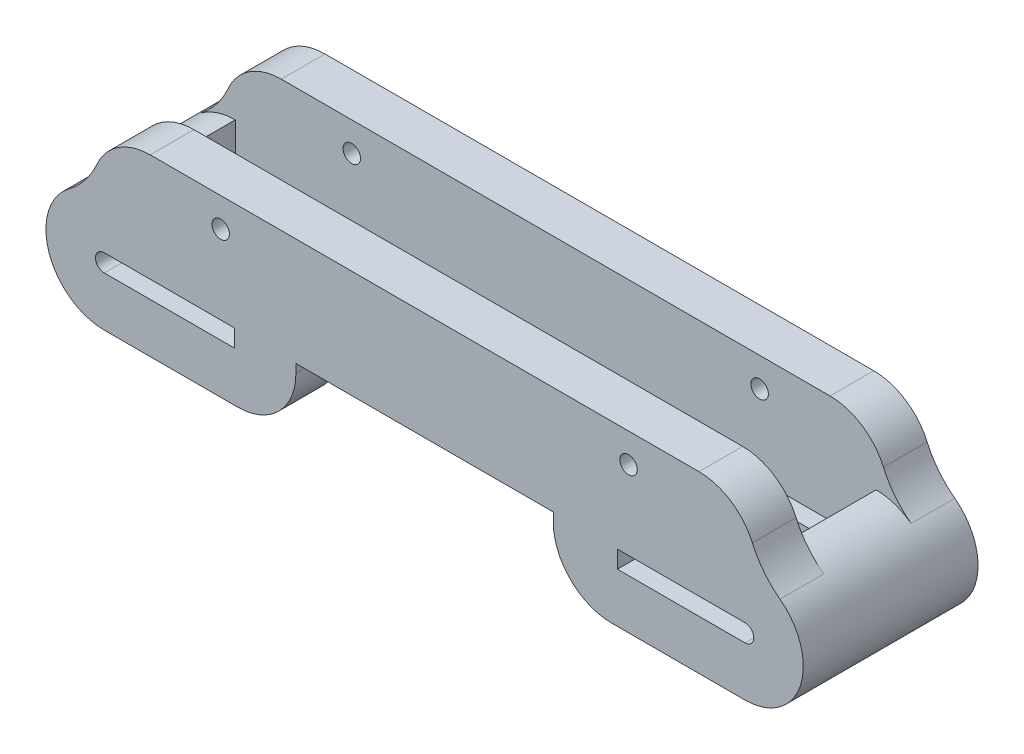
from build123d import *

# Parameters (mm, degrees)
BOSS_EXTRU_1_DEPTH           = 30
ESQUISSE2_W                  = 110
ESQUISSE2_H                  = 15
ENL_V_MAT_EXTRU_1_DEPTH      = 30
ENL_V_START                  = -10
ESQUISSE3_W                  = 44.19
ESQUISSE3_H                  = 7.5
ENL_V_MAT_EXTRU_2_DEPTH      = 10
ESQUISSE4_W                  = 5
ESQUISSE4_H                  = 7.5
BOSS_EXTRU_2_DEPTH           = 10
ESQUISSE5_W                  = 7.5
ESQUISSE5_H                  = 3
BOSS_EXTRU_3_DEPTH           = 6
ESQUISSE6_W                  = 7.5
ESQUISSE6_H                  = 3
BOSS_EXTRU_4_DEPTH           = 5.5
CONG_1_R                     = 10
ESQUISSE7_W                  = 110
ESQUISSE7_H                  = 7.5
BOSS_EXTRU_5_DEPTH           = 10
ENL_V_MAT_EXTRU_3_DEPTH      = 72.632743909
ENL_V_MAT_EXTRU_3_DEPTH_BACK = 72.632743909
ESQUISSE8_R                  = 1.5
CONG_2_R                     = 15
CONG_3_R                     = 15
CONG_4_R                     = 15
CONG_5_R                     = 15
CONG_6_R                     = 10


with BuildPart() as part:
    # Esquisse1 → Boss.-Extru.1 (new body)
    with BuildSketch(Plane.XY):
        with BuildLine():
            Line((-55, 10), (55, 10))
            ThreePointArc((55, 10), (65, 0), (55, -10))
            Line((55, -10), (-55, -10))
            ThreePointArc((-55, -10), (-65, 0), (-55, 10))
        make_face()
        with BuildLine():
            Line((-55, 1.5), (55, 1.5))
            ThreePointArc((55, 1.5), (56.5, 0), (55, -1.5))
            Line((55, -1.5), (-55, -1.5))
            ThreePointArc((-55, -1.5), (-56.5, 0), (-55, 1.5))
        make_face(mode=Mode.SUBTRACT)
    extrude(amount=BOSS_EXTRU_1_DEPTH)

    # Esquisse2 → Enlèv. mat.-Extru.1 (cut)
    with BuildSketch(Plane(origin=(0, 10, 0), x_dir=(1, 0, 0), z_dir=(0, 1, 0))):
        with Locations((0, -15)):
            Rectangle(ESQUISSE2_W, ESQUISSE2_H)
    extrude(amount=-ENL_V_MAT_EXTRU_1_DEPTH, mode=Mode.SUBTRACT)

    # Esquisse3 → Enlèv. mat.-Extru.2 (cut)
    with BuildSketch(Plane(origin=(0, 10, 0), x_dir=(1, 0, 0), z_dir=(0, 1, 0)).offset(ENL_V_START)):
        with Locations((0, -26.25)):
            Rectangle(ESQUISSE3_W, ESQUISSE3_H)
    extrude(amount=-ENL_V_MAT_EXTRU_2_DEPTH, mode=Mode.SUBTRACT)

    # Esquisse4 → Boss.-Extru.2 (add)
    with BuildSketch(Plane(origin=(0, -1.5, 0), x_dir=(1, 0, 0), z_dir=(0, 1, 0))):
        with Locations((-24.595, -26.25)):
            Rectangle(ESQUISSE4_W, ESQUISSE4_H)
        with Locations((24.595, -26.25)):
            Rectangle(ESQUISSE4_W, ESQUISSE4_H)
    extrude(amount=BOSS_EXTRU_2_DEPTH)

    # Esquisse5 → Boss.-Extru.3 (add)
    with BuildSketch(Plane(origin=(27.095, 0, 0), x_dir=(0, 0, -1), z_dir=(1, 0, 0))):
        with Locations((-26.25, 0)):
            Rectangle(ESQUISSE5_W, ESQUISSE5_H)
    extrude(amount=BOSS_EXTRU_3_DEPTH)

    # Esquisse6 → Boss.-Extru.4 (add)
    with BuildSketch(Plane.ZY.offset(27.095)):
        with Locations((26.25, 0)):
            Rectangle(ESQUISSE6_W, ESQUISSE6_H)
    extrude(amount=BOSS_EXTRU_4_DEPTH)

    # Congé1
    cong_1_edges = [part.edges().sort_by_distance(p)[0] for p in [
        (22.095, -10, 26.25),
        (-22.095, -10, 26.25),
    ]]
    fillet(cong_1_edges, radius=CONG_1_R)

    # Esquisse7 → Boss.-Extru.5 (add)
    with BuildSketch(Plane(origin=(0, 10, 0), x_dir=(1, 0, 0), z_dir=(0, 1, 0))):
        with Locations((0, -3.75)):
            Rectangle(ESQUISSE7_W, ESQUISSE7_H)
        with Locations((0, -26.25)):
            Rectangle(ESQUISSE7_W, ESQUISSE7_H)
    extrude(amount=BOSS_EXTRU_5_DEPTH)

    # Esquisse8 → Enlèv. mat.-Extru.3 (cut, two sides: drawn at the far end of the back side and taken through both)
    with BuildSketch(Plane.XY.offset(7.5).offset(-ENL_V_MAT_EXTRU_3_DEPTH_BACK)):
        with Locations((-35, 15)):
            Circle(ESQUISSE8_R)
        with Locations((35, 15)):
            Circle(ESQUISSE8_R)
    extrude(amount=ENL_V_MAT_EXTRU_3_DEPTH + ENL_V_MAT_EXTRU_3_DEPTH_BACK, mode=Mode.SUBTRACT)

    # Congé2
    cong_2_edges = [part.edges().sort_by_distance(p)[0] for p in [
        (-55, 10, 3.75),
    ]]
    fillet(cong_2_edges, radius=CONG_2_R - 0.0001)  # a hair under: the kernel refuses the full size

    # Congé3
    cong_3_edges = [part.edges().sort_by_distance(p)[0] for p in [
        (55, 10, 3.75),
    ]]
    fillet(cong_3_edges, radius=CONG_3_R - 0.0001)  # a hair under: the kernel refuses the full size

    # Congé4
    cong_4_edges = [part.edges().sort_by_distance(p)[0] for p in [
        (-55, 10, 26.25),
    ]]
    fillet(cong_4_edges, radius=CONG_4_R - 0.0001)  # a hair under: the kernel refuses the full size

    # Congé5
    cong_5_edges = [part.edges().sort_by_distance(p)[0] for p in [
        (55, 10, 26.25),
    ]]
    fillet(cong_5_edges, radius=CONG_5_R - 0.0001)  # a hair under: the kernel refuses the full size

    # Congé6
    cong_6_edges = [part.edges().sort_by_distance(p)[0] for p in [
        (-55, 20, 3.75),
        (55, 20, 3.75),
        (55, 20, 26.25),
        (-55, 20, 26.25),
    ]]
    fillet(cong_6_edges, radius=CONG_6_R)


solid = part.part
